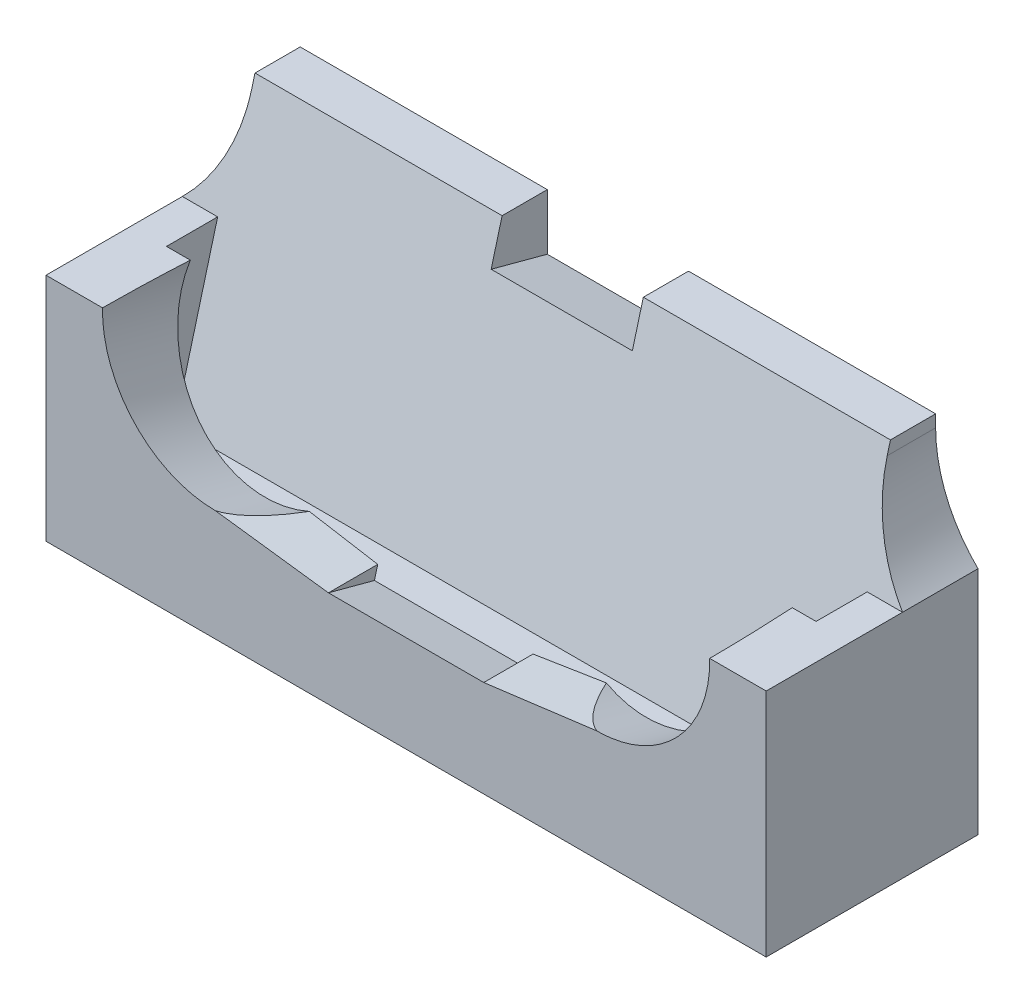
from build123d import *

# Parameters (mm, degrees)
SKETCH1_W           = 45
SKETCH1_H           = 15
BOSS_EXTRUDE1_DEPTH = 5
BOSS_EXTRUDE2_DEPTH = 45
SKETCH5_R           = 8
CUT_EXTRUDE1_DEPTH  = 10
CUT_EXTRUDE2_REACH  = 39.075
SKETCH6_W           = 45
SKETCH6_H           = 8
SKETCH7_W           = 11
SKETCH7_H           = 10.717790556
CUT_EXTRUDE4_DEPTH  = 6.5
CUT_EXTRUDE5_REACH  = 39.075
SKETCH10_W          = 15
SKETCH10_H          = 16.318516526
BOSS_EXTRUDE3_DEPTH = 3
SKETCH11_W          = 15
SKETCH11_H          = 16.318516526
BOSS_EXTRUDE4_DEPTH = 3
SKETCH12_W          = 10
SKETCH12_H          = 7.679226714
CUT_EXTRUDE6_DEPTH  = 6
FILLET1_R           = 10
CUT_EXTRUDE7_DEPTH  = 0.5
CUT_EXTRUDE8_DEPTH  = 0.5


with BuildPart() as part:
    # Sketch1 → Boss-Extrude1 (new body)
    with BuildSketch(Plane(origin=(0, 0, 0), x_dir=(1, 0, 0), z_dir=(0, 1, 0))):
        with Locations((1.125, 2.045454545)):
            Rectangle(SKETCH1_W, SKETCH1_H)
    extrude(amount=BOSS_EXTRUDE1_DEPTH)

    # Sketch2 → Boss-Extrude2 (add)
    with BuildSketch(Plane(origin=(23.625, 0, 0), x_dir=(0, 0, -1), z_dir=(1, 0, 0))):
        Polygon((-2.454545455, 5), (2.721835448, 24.318516526), (-5.454545455, 24.318516526), (-5.454545455, 5), align=None)
        Polygon((1.168921177, 5), (6.345302079, 24.318516526), (9.545454545, 24.318516526), (9.545454545, 5), align=None)
    extrude(amount=-BOSS_EXTRUDE2_DEPTH)

    # Sketch5 → Cut-Extrude1 (cut)
    with BuildSketch(Plane(origin=(0, 0.948572854, 3.540122086), x_dir=(-1, 0, 0), z_dir=(0, -0.2588190451025247, -0.9659258262890673))):
        with Locations(Location((12.375, 14.194346021, 0), (0, 0, 90))):
            Circle(SKETCH5_R)
        with Locations(Location((-14.625, 14.194346021, 0), (0, 0, 90))):
            Circle(SKETCH5_R)
    extrude(amount=-CUT_EXTRUDE1_DEPTH, mode=Mode.SUBTRACT)

    # Cut-Extrude2: up to this plane
    cut_extrude2_end = Plane(origin=(-21.375, 5, 2.454545455), z_dir=(0, -0.2588190451025246, -0.9659258262890673))
    # Sketch6 → Cut-Extrude2 (cut, up to the surface)
    with BuildSketch(Plane.XY.offset(5.454545455), mode=Mode.PRIVATE) as cut_extrude2_sk1:
        with Locations((1.125, 20.318516526)):
            Rectangle(SKETCH6_W, SKETCH6_H)
    cut_extrude2_tool1 = split(extrude(cut_extrude2_sk1.sketch, amount=-CUT_EXTRUDE2_REACH, mode=Mode.PRIVATE), bisect_by=cut_extrude2_end, keep=Keep.BOTH, mode=Mode.PRIVATE)
    add(cut_extrude2_tool1.solids().sort_by_distance((1.125, 20.318517, 5.454545))[0], mode=Mode.SUBTRACT)

    # Sketch7 → Cut-Extrude4 (cut)
    with BuildSketch(Plane(origin=(0, 0.948572854, 3.540122086), x_dir=(-1, 0, 0), z_dir=(0, -0.2588190451025247, -0.9659258262890673))):
        with Locations((-1.125, 10.553241299)):
            Rectangle(SKETCH7_W, SKETCH7_H)
    extrude(amount=-CUT_EXTRUDE4_DEPTH, mode=Mode.SUBTRACT)


with BuildPart() as cut_extrude4_piece_1:
    # of the separate pieces the step leaves, piece 1, a body of its own (cut_extrude4_pieces)
    add(part.part.solids().sort_by_distance((-21.375, 0, -9.545454545))[0])


with BuildPart() as cut_extrude4_piece_2:
    # of the separate pieces the step leaves, piece 2, a body of its own (cut_extrude4_pieces)
    add(part.part.solids().sort_by_distance((-4.375, 16.318516526, -0.578241908))[0])


with BuildPart() as cut_extrude4_piece_3:
    # of the separate pieces the step leaves, piece 3, a body of its own (cut_extrude4_pieces)
    add(part.part.solids().sort_by_distance((6.811601533, 16.318516526, -0.578241908))[0])


with BuildPart() as cut_extrude5_tool:
    # Cut-Extrude5: up to this plane
    cut_extrude5_end = Plane(origin=(-21.375, 5, 2.454545455), z_dir=(0, -0.2588190451025246, -0.9659258262890673))
    # Sketch9 → Cut-Extrude5 (new, up to the surface)
    with BuildSketch(Plane.XY.offset(5.454545455), mode=Mode.PRIVATE) as cut_extrude5_sk1:
        Polygon((-12.375, 7.874399938), (-4.375, 6.839123758), (6.625, 6.839123758), (14.625, 7.874399938), (14.625, 17.142741254), (-12.375, 17.142741254), align=None)
    cut_extrude5_tool1 = split(extrude(cut_extrude5_sk1.sketch, amount=-CUT_EXTRUDE5_REACH, mode=Mode.PRIVATE), bisect_by=cut_extrude5_end, keep=Keep.BOTH, mode=Mode.PRIVATE)
    add(cut_extrude5_tool1.solids().sort_by_distance((1.125, 12.138424, 5.454545))[0])


with BuildPart() as cut_extrude4_piece_1_1:
    add(cut_extrude4_piece_1.part)

    # Cut-Extrude5: cut by cut_extrude5_tool
    add(cut_extrude5_tool.part, mode=Mode.SUBTRACT)

    # Sketch10 → Boss-Extrude3 (add)
    with BuildSketch(Plane.ZY.offset(21.375)):
        with Locations((-2.045454545, 8.159258263)):
            Rectangle(SKETCH10_W, SKETCH10_H)
    extrude(amount=BOSS_EXTRUDE3_DEPTH)

    # Sketch11 → Boss-Extrude4 (add)
    with BuildSketch(Plane(origin=(23.625, 0, 0), x_dir=(0, 0, -1), z_dir=(1, 0, 0))):
        with Locations((2.045454545, 8.159258263)):
            Rectangle(SKETCH11_W, SKETCH11_H)
    extrude(amount=BOSS_EXTRUDE4_DEPTH)

    # Sketch12 → Cut-Extrude6 (cut)
    with BuildSketch(Plane(origin=(0, 0.042706196, 0.159381694), x_dir=(1, 0, 0), z_dir=(0, 0.2588190451025247, 0.9659258262890673))):
        with Locations((1.125, 25.971781551)):
            Rectangle(SKETCH12_W, SKETCH12_H)
    extrude(amount=-CUT_EXTRUDE6_DEPTH, mode=Mode.SUBTRACT)

    # Fillet1
    # the kernel refuses this fillet: 10 mm, written as the material it adds along each edge
    with BuildSketch(Plane(origin=(-21.375, 16.318516526, 13.651862532), x_dir=(-1, 0, 0), z_dir=(0, 0, -1))) as fillet1_piece_1_section:
        with BuildLine():
            CenterArc((10, 7.141428429), FILLET1_R, 180, 45.572995999)
            Line((0, 7.141428429), (0, 0))
            Line((0, 0), (3, 0))
        make_face()
    fillet1_piece_1 = extrude(amount=23.197317077, mode=Mode.PRIVATE)
    fillet1_piece_1 = split(fillet1_piece_1, bisect_by=Plane(origin=(-22.137016454, 20.028758468, -5.195864872), z_dir=(0, -0.2588190451025247, -0.9659258262890673)), keep=Keep.TOP, mode=Mode.PRIVATE)
    add(fillet1_piece_1)
    with BuildSketch(Plane(origin=(23.625, 16.318516526, 13.651862532), x_dir=(1, 0, 0), z_dir=(0, 0, -1))) as fillet1_piece_2_section:
        with BuildLine():
            CenterArc((10, -7.141428429), FILLET1_R, 134.427004001, 45.572995999)
            Line((0, -7.141428429), (0, 0))
            Line((0, 0), (3, 0))
        make_face()
    fillet1_piece_2 = extrude(amount=23.197317077, mode=Mode.PRIVATE)
    fillet1_piece_2 = split(fillet1_piece_2, bisect_by=Plane(origin=(24.387016454, 20.028758468, -5.195864872), z_dir=(0, -0.2588190451025247, -0.9659258262890673)), keep=Keep.TOP, mode=Mode.PRIVATE)
    add(fillet1_piece_2)

    # Sketch14 → Cut-Extrude7 (cut)
    with BuildSketch(Plane(origin=(-21.375, 0, 0), x_dir=(0, 0, -1), z_dir=(1, 0, 0))):
        Polygon((0.578241908, 16.318516526), (4.201708539, 16.318516526), (1.168921177, 5), (-2.454545455, 5), align=None)
    extrude(amount=-CUT_EXTRUDE7_DEPTH, mode=Mode.SUBTRACT)

    # Sketch15 → Cut-Extrude8 (cut)
    with BuildSketch(Plane.ZY.offset(-23.625)):
        Polygon((-4.201708539, 16.318516526), (-0.578241908, 16.318516526), (2.454545455, 5), (-1.168921177, 5), align=None)
    extrude(amount=-CUT_EXTRUDE8_DEPTH, mode=Mode.SUBTRACT)


with BuildPart() as cut_extrude4_piece_2_1:
    add(cut_extrude4_piece_2.part)

    # Cut-Extrude5: cut by cut_extrude5_tool
    add(cut_extrude5_tool.part, mode=Mode.SUBTRACT)


with BuildPart() as cut_extrude4_piece_3_1:
    add(cut_extrude4_piece_3.part)

    # Cut-Extrude5: cut by cut_extrude5_tool
    add(cut_extrude5_tool.part, mode=Mode.SUBTRACT)


solid = cut_extrude4_piece_1_1.part
